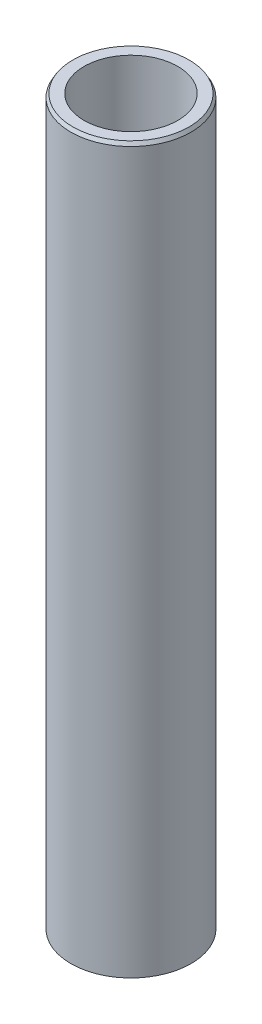
from build123d import *
from OCP.BRepFilletAPI import BRepFilletAPI_MakeChamfer

# Parameters (mm, degrees)
SKETCH1_R           = 45
BOSS_EXTRUDE1_DEPTH = 543.138858771
SKETCH2_R           = 35.077465654
CUT_EXTRUDE1_DEPTH  = 547.854477816
CHAMFER1_SIZE       = 2.634811073
CHAMFER1_SIZE2      = 1.521208883


with BuildPart() as part:
    # Sketch1 → Boss-Extrude1 (new body)
    with BuildSketch(Plane(origin=(0, 0, 0), x_dir=(1, 0, 0), z_dir=(0, 1, 0))):
        Circle(SKETCH1_R)
    extrude(amount=BOSS_EXTRUDE1_DEPTH)

    # Sketch2 → Cut-Extrude1 (cut, through all)
    with BuildSketch(Plane(origin=(0, 0, 0), x_dir=(1, 0, 0), z_dir=(0, 1, 0))):
        Circle(SKETCH2_R)
    extrude(amount=CUT_EXTRUDE1_DEPTH, mode=Mode.SUBTRACT)

    # Chamfer1: one chamfer whose edges measure the first distance from different faces: ONE call of the kernel's chamfer builder (chamfer() names one face for all edges)
    chamfer1_edges_1 = [part.edges().sort_by_distance(p)[0] for p in [
        (-45, 543.138858771, 0),
    ]]
    chamfer1_side_1 = [part.faces().sort_by_distance(p)[0] for p in [
        (-45, 271.569429385, 0),
    ]]
    chamfer1_edges_2 = [part.edges().sort_by_distance(p)[0] for p in [
        (-45, 0, 0),
    ]]
    chamfer1_side_2 = [part.faces().sort_by_distance(p)[0] for p in [
        (-43.727207794, 0, 0),
    ]]
    chamfer1 = BRepFilletAPI_MakeChamfer(part.part.solid().wrapped)
    for e in chamfer1_edges_1:
        chamfer1.Add(CHAMFER1_SIZE, CHAMFER1_SIZE2, e.wrapped, chamfer1_side_1[0].wrapped)  # the first distance lies on this face
    for e in chamfer1_edges_2:
        chamfer1.Add(CHAMFER1_SIZE, CHAMFER1_SIZE2, e.wrapped, chamfer1_side_2[0].wrapped)  # the first distance lies on this face
    add(Compound.cast(chamfer1.Shape()), mode=Mode.REPLACE)


solid = part.part
